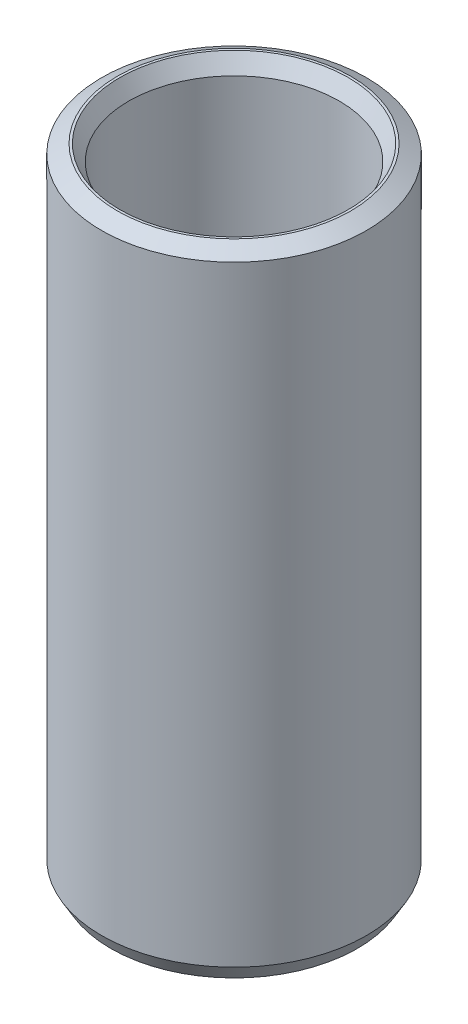
from build123d import *
from OCP.BRepFilletAPI import BRepFilletAPI_MakeChamfer

# Parameters (mm, degrees)
SKETCH1_R           = 25
BOSS_EXTRUDE1_DEPTH = 119.924512625
SKETCH2_R           = 19.867844167
CUT_EXTRUDE1_DEPTH  = 126.027551877
CHAMFER1_SIZE       = 1.714947866
CHAMFER1_SIZE2      = 2.970376837


with BuildPart() as part:
    # Sketch1 → Boss-Extrude1 (new body)
    with BuildSketch(Plane(origin=(0, 0, 0), x_dir=(1, 0, 0), z_dir=(0, 1, 0))):
        Circle(SKETCH1_R)
    extrude(amount=BOSS_EXTRUDE1_DEPTH)

    # Sketch2 → Cut-Extrude1 (cut, through all)
    with BuildSketch(Plane(origin=(0, 0, 0), x_dir=(1, 0, 0), z_dir=(0, 1, 0))):
        Circle(SKETCH2_R)
    extrude(amount=CUT_EXTRUDE1_DEPTH, mode=Mode.SUBTRACT)

    # Chamfer1: one chamfer whose edges measure the first distance from different faces: ONE call of the kernel's chamfer builder (chamfer() names one face for all edges)
    chamfer1_edges_1 = [part.edges().sort_by_distance(p)[0] for p in [
        (-19.867844167, 119.924512625, 0),
    ]]
    chamfer1_side_1 = [part.faces().sort_by_distance(p)[0] for p in [
        (-24.292893219, 119.924512625, 0),
    ]]
    chamfer1_edges_2 = [part.edges().sort_by_distance(p)[0] for p in [
        (-19.867844167, 0, 0),
    ]]
    chamfer1_side_2 = [part.faces().sort_by_distance(p)[0] for p in [
        (-19.867844167, 59.962256313, 0),
    ]]
    chamfer1_edges_3 = [part.edges().sort_by_distance(p)[0] for p in [
        (-25, 0, 0),
    ]]
    chamfer1_side_3 = [part.faces().sort_by_distance(p)[0] for p in [
        (-24.292893219, 0, 0),
    ]]
    chamfer1_edges_4 = [part.edges().sort_by_distance(p)[0] for p in [
        (-25, 119.924512625, 0),
    ]]
    chamfer1_side_4 = [part.faces().sort_by_distance(p)[0] for p in [
        (-25, 59.962256313, 0),
    ]]
    chamfer1 = BRepFilletAPI_MakeChamfer(part.part.solid().wrapped)
    for e in chamfer1_edges_1:
        chamfer1.Add(CHAMFER1_SIZE, CHAMFER1_SIZE2, e.wrapped, chamfer1_side_1[0].wrapped)  # the first distance lies on this face
    for e in chamfer1_edges_2:
        chamfer1.Add(CHAMFER1_SIZE, CHAMFER1_SIZE2, e.wrapped, chamfer1_side_2[0].wrapped)  # the first distance lies on this face
    for e in chamfer1_edges_3:
        chamfer1.Add(CHAMFER1_SIZE, CHAMFER1_SIZE2, e.wrapped, chamfer1_side_3[0].wrapped)  # the first distance lies on this face
    for e in chamfer1_edges_4:
        chamfer1.Add(CHAMFER1_SIZE, CHAMFER1_SIZE2, e.wrapped, chamfer1_side_4[0].wrapped)  # the first distance lies on this face
    add(Compound.cast(chamfer1.Shape()), mode=Mode.REPLACE)


solid = part.part
